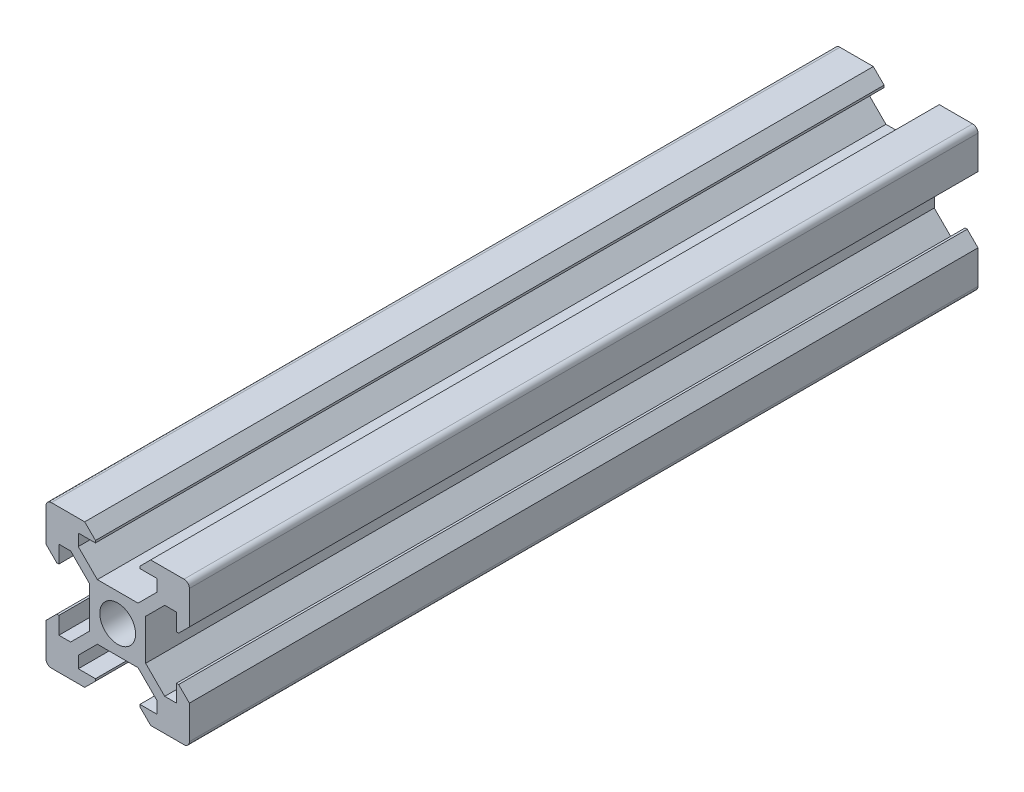
from build123d import *

# Parameters (mm, degrees)
CROQUIS1_R              = 2.5
SALIENTE_EXTRUIR1_DEPTH = 110


with BuildPart() as part:
    # Croquis1 → Saliente-Extruir1 (new body)
    with BuildSketch(Plane.XY):
        with BuildLine():
            Line((-4.6, 10), (-3.1, 8.5))
            Line((-3.1, 8.5), (-3.1, 8.2))
            Line((-3.1, 8.2), (-5.5, 8.2))
            Line((-5.5, 8.2), (-5.5, 6.560660172))
            Line((-5.5, 6.560660172), (-2.84, 3.900660172))
            Line((-2.84, 3.900660172), (0, 3.900660172))
            Line((0, 3.900660172), (2.84, 3.900660172))
            Line((2.84, 3.900660172), (5.5, 6.560660172))
            Line((5.5, 6.560660172), (5.5, 8.2))
            Line((5.5, 8.2), (3.1, 8.2))
            Line((3.1, 8.2), (3.1, 8.5))
            Line((3.1, 8.5), (4.6, 10))
            Line((4.6, 10), (9.25, 10))
            ThreePointArc((9.25, 10), (9.780330086, 9.780330086), (10, 9.25))
            Line((10, 9.25), (10, 4.6))
            Line((10, 4.6), (8.5, 3.1))
            Line((8.5, 3.1), (8.2, 3.1))
            Line((8.2, 3.1), (8.2, 5.5))
            Line((8.2, 5.5), (6.560660172, 5.5))
            Line((6.560660172, 5.5), (3.900660172, 2.84))
            Line((3.900660172, 2.84), (3.900660172, 0))
            Line((3.900660172, 0), (3.900660172, -2.84))
            Line((3.900660172, -2.84), (6.560660172, -5.5))
            Line((6.560660172, -5.5), (8.2, -5.5))
            Line((8.2, -5.5), (8.2, -3.1))
            Line((8.2, -3.1), (8.5, -3.1))
            Line((8.5, -3.1), (10, -4.6))
            Line((10, -4.6), (10, -9.25))
            ThreePointArc((10, -9.25), (9.780330086, -9.780330086), (9.25, -10))
            Line((9.25, -10), (4.6, -10))
            Line((4.6, -10), (3.1, -8.5))
            Line((3.1, -8.5), (3.1, -8.2))
            Line((3.1, -8.2), (5.5, -8.2))
            Line((5.5, -8.2), (5.5, -6.560660172))
            Line((5.5, -6.560660172), (2.84, -3.900660172))
            Line((2.84, -3.900660172), (0, -3.900660172))
            Line((0, -3.900660172), (-2.84, -3.900660172))
            Line((-2.84, -3.900660172), (-5.5, -6.560660172))
            Line((-5.5, -6.560660172), (-5.5, -8.2))
            Line((-5.5, -8.2), (-3.1, -8.2))
            Line((-3.1, -8.2), (-3.1, -8.5))
            Line((-3.1, -8.5), (-4.6, -10))
            Line((-4.6, -10), (-9.25, -10))
            ThreePointArc((-9.25, -10), (-9.780330086, -9.780330086), (-10, -9.25))
            Line((-10, -9.25), (-10, -4.6))
            Line((-10, -4.6), (-8.5, -3.1))
            Line((-8.5, -3.1), (-8.2, -3.1))
            Line((-8.2, -3.1), (-8.2, -5.5))
            Line((-8.2, -5.5), (-6.560660172, -5.5))
            Line((-6.560660172, -5.5), (-3.900660172, -2.84))
            Line((-3.900660172, -2.84), (-3.900660172, 0))
            Line((-3.900660172, 0), (-3.900660172, 2.84))
            Line((-3.900660172, 2.84), (-6.560660172, 5.5))
            Line((-6.560660172, 5.5), (-8.2, 5.5))
            Line((-8.2, 5.5), (-8.2, 3.1))
            Line((-8.2, 3.1), (-8.5, 3.1))
            Line((-8.5, 3.1), (-10, 4.6))
            Line((-10, 4.6), (-10, 9.25))
            ThreePointArc((-10, 9.25), (-9.780330086, 9.780330086), (-9.25, 10))
            Line((-9.25, 10), (-4.6, 10))
        make_face()
        Circle(CROQUIS1_R, mode=Mode.SUBTRACT)
    extrude(amount=SALIENTE_EXTRUIR1_DEPTH)


solid = part.part
